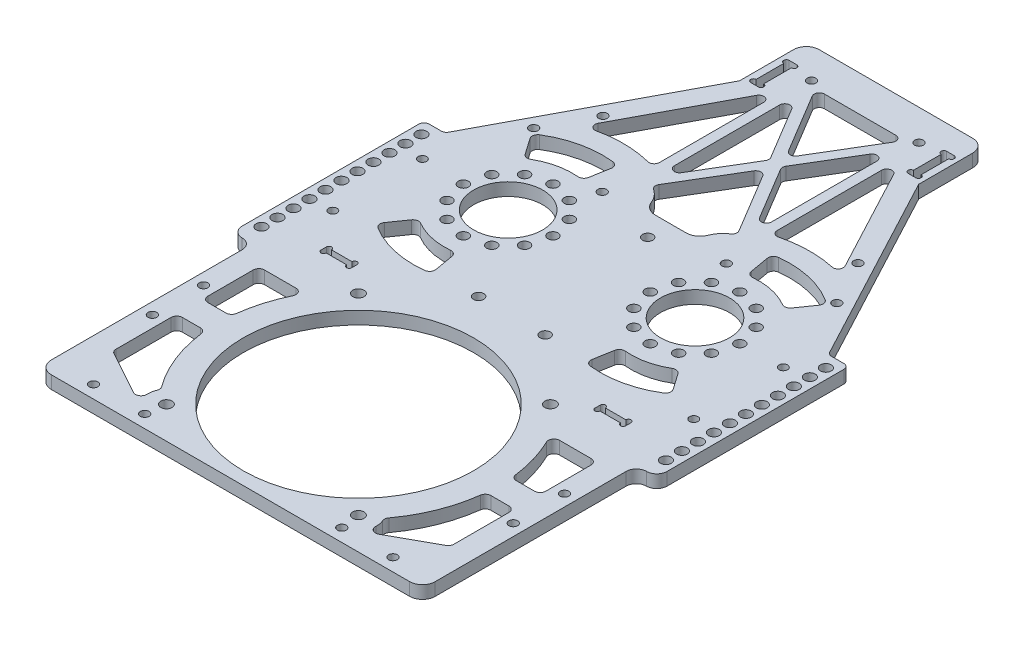
from build123d import *

# Parameters (mm, degrees)
SKETCH_1_R             = 13.5
SKETCH_1_R_2           = 2
SKETCH_1_R_3           = 45
EXTRUDE_1_DEPTH        = 5
SKETCH_3_R             = 1.7
CUT_EXTRUDE_2_DEPTH    = 164.324829711
SKETCH_4_R             = 2.2
CUT_EXTRUDE_3_DEPTH    = 164.324829711
CUT_EXTRUDE_4_DEPTH    = 10
CUT_EXTRUDE_5_DEPTH    = 10
FILLET_1_DEPTH         = 5
CUT_EXTRUDE_6_DEPTH    = 10
FILLET_2_R             = 2
CUT_EXTRUDE_7_DEPTH    = 164.324829711
FILLET_3_R             = 2
FILLET_5_R             = 5
SKETCH_9_R             = 1.05
SKETCH_9_W             = 3
SKETCH_9_H             = 15
CUT_EXTRUDE_8_DEPTH    = 164.324829711
FILLET_3_OF_MIRROR_1_R = 2
FILLET_6_R             = 20
EXTRUDE_START          = -5
EXTRUDE_2_DEPTH        = 5
FILLET_7_R             = 2.2
SKETCH_12_R            = 1
SKETCH_12_W            = 12
SKETCH_12_H            = 2.1
CUT_EXTRUDE_10_DEPTH   = 10
SKETCH_14_R            = 1.5
CUT_EXTRUDE_11_DEPTH   = 164.324829711
CUT_EXTRUDE_12_DEPTH   = 164.324829711
FILLET_8_R             = 10
SKETCH_16_W            = 8
SKETCH_16_H            = 75.05079277
EXTRUDE_3_DEPTH        = 5
FILLET_START           = -1
FILLET_9_DEPTH         = 7
FILLET_9_2_DEPTH       = 5
SKETCH_17_R            = 1.65
CUT_EXTRUDE_13_DEPTH   = 168.149633702
SKETCH_18_R            = 2.1
CUT_EXTRUDE_14_DEPTH   = 168.149633702
FILLET_10_R            = 2
SKETCH_19_R            = 2
CUT_EXTRUDE_15_DEPTH   = 10


with BuildPart() as part:
    # 草图1 → 凸台-拉伸1 (new body)
    with BuildSketch(Plane(origin=(0, 0, 0), x_dir=(1, 0, 0), z_dir=(0, 1, 0))):
        Polygon((-35, 88.881349096), (-75, 13.627385249), (-75, -145), (75, -145), (75, 13.627385249), (35, 88.881349096), (35, 115), (-35, 115), align=None)
        with Locations(Location((36.5, 0, 0), (0, 0, 270))):
            Circle(SKETCH_1_R, mode=Mode.SUBTRACT)
        with Locations(Location((-36.5, 0, 0), (0, 0, 270))):
            Circle(SKETCH_1_R, mode=Mode.SUBTRACT)
        with Locations(Location((36.5, 17.5, 0), (0, 0, 270))):
            Circle(SKETCH_1_R_2, mode=Mode.SUBTRACT)
        with Locations(Location((45.25, 15.155444566, 0), (0, 0, 270))):
            Circle(SKETCH_1_R_2, mode=Mode.SUBTRACT)
        with Locations(Location((51.655444566, 8.75, 0), (0, 0, 270))):
            Circle(SKETCH_1_R_2, mode=Mode.SUBTRACT)
        with Locations(Location((54, 0, 0), (0, 0, 270))):
            Circle(SKETCH_1_R_2, mode=Mode.SUBTRACT)
        with Locations(Location((51.655444566, -8.75, 0), (0, 0, 270))):
            Circle(SKETCH_1_R_2, mode=Mode.SUBTRACT)
        with Locations(Location((45.25, -15.155444566, 0), (0, 0, 270))):
            Circle(SKETCH_1_R_2, mode=Mode.SUBTRACT)
        with Locations(Location((36.5, -17.5, 0), (0, 0, 270))):
            Circle(SKETCH_1_R_2, mode=Mode.SUBTRACT)
        with Locations(Location((27.75, -15.155444566, 0), (0, 0, 270))):
            Circle(SKETCH_1_R_2, mode=Mode.SUBTRACT)
        with Locations(Location((21.344555434, -8.75, 0), (0, 0, 270))):
            Circle(SKETCH_1_R_2, mode=Mode.SUBTRACT)
        with Locations(Location((19, 0, 0), (0, 0, 270))):
            Circle(SKETCH_1_R_2, mode=Mode.SUBTRACT)
        with Locations(Location((21.344555434, 8.75, 0), (0, 0, 270))):
            Circle(SKETCH_1_R_2, mode=Mode.SUBTRACT)
        with Locations(Location((27.75, 15.155444566, 0), (0, 0, 270))):
            Circle(SKETCH_1_R_2, mode=Mode.SUBTRACT)
        with Locations(Location((-36.5, -17.5, 0), (0, 0, 270))):
            Circle(SKETCH_1_R_2, mode=Mode.SUBTRACT)
        with Locations(Location((-45.25, -15.155444566, 0), (0, 0, 270))):
            Circle(SKETCH_1_R_2, mode=Mode.SUBTRACT)
        with Locations(Location((-51.655444566, -8.75, 0), (0, 0, 270))):
            Circle(SKETCH_1_R_2, mode=Mode.SUBTRACT)
        with Locations(Location((-51.655444566, 8.75, 0), (0, 0, 270))):
            Circle(SKETCH_1_R_2, mode=Mode.SUBTRACT)
        with Locations(Location((-45.25, 15.155444566, 0), (0, 0, 270))):
            Circle(SKETCH_1_R_2, mode=Mode.SUBTRACT)
        with Locations(Location((-36.5, 17.5, 0), (0, 0, 270))):
            Circle(SKETCH_1_R_2, mode=Mode.SUBTRACT)
        with Locations(Location((-27.75, 15.155444566, 0), (0, 0, 270))):
            Circle(SKETCH_1_R_2, mode=Mode.SUBTRACT)
        with Locations(Location((-21.344555434, 8.75, 0), (0, 0, 270))):
            Circle(SKETCH_1_R_2, mode=Mode.SUBTRACT)
        with Locations(Location((-21.344555434, -8.75, 0), (0, 0, 270))):
            Circle(SKETCH_1_R_2, mode=Mode.SUBTRACT)
        with Locations(Location((-27.75, -15.155444566, 0), (0, 0, 270))):
            Circle(SKETCH_1_R_2, mode=Mode.SUBTRACT)
        with Locations(Location((-19, 0, 0), (0, 0, 270))):
            Circle(SKETCH_1_R_2, mode=Mode.SUBTRACT)
        with Locations(Location((-54, 0, 0), (0, 0, 270))):
            Circle(SKETCH_1_R_2, mode=Mode.SUBTRACT)
        with Locations(Location((0, -95, 0), (0, 0, 270))):
            Circle(SKETCH_1_R_3, mode=Mode.SUBTRACT)
    extrude(amount=EXTRUDE_1_DEPTH)

    # 草图3 → 切除-拉伸2 (cut, through all)
    with BuildSketch(Plane(origin=(0, 5, 0), x_dir=(1, 0, 0), z_dir=(0, 1, 0))):
        with Locations(Location((49.82296811, 50.341150246, 0), (0, 0, 270))):
            Circle(SKETCH_3_R)
        with Locations(Location((59.209976564, 32.680910376, 0), (0, 0, 270))):
            Circle(SKETCH_3_R)
        with Locations(Location((24.25, 24.5, 0), (0, 0, 270))):
            Circle(SKETCH_3_R)
        with Locations(Location((70.5, -85, 0), (0, 0, 270))):
            Circle(SKETCH_3_R)
        with Locations(Location((70.5, -105, 0), (0, 0, 270))):
            Circle(SKETCH_3_R)
        with Locations(Location((58.5, -140, 0), (0, 0, 270))):
            Circle(SKETCH_3_R)
        with Locations(Location((38.5, -140, 0), (0, 0, 270))):
            Circle(SKETCH_3_R)
        with Locations(Location((21, 103, 0), (0, 0, 270))):
            Circle(SKETCH_3_R)
        with Locations(Location((-21, 103, 0), (0, 0, 90))):
            Circle(SKETCH_3_R)
        with Locations(Location((-38.5, -140, 0), (0, 0, 90))):
            Circle(SKETCH_3_R)
        with Locations(Location((-58.5, -140, 0), (0, 0, 90))):
            Circle(SKETCH_3_R)
        with Locations(Location((-70.5, -105, 0), (0, 0, 90))):
            Circle(SKETCH_3_R)
        with Locations(Location((-70.5, -85, 0), (0, 0, 90))):
            Circle(SKETCH_3_R)
        with Locations(Location((-24.25, 24.5, 0), (0, 0, 90))):
            Circle(SKETCH_3_R)
        with Locations(Location((-59.209976564, 32.680910376, 0), (0, 0, 90))):
            Circle(SKETCH_3_R)
        with Locations(Location((-49.82296811, 50.341150246, 0), (0, 0, 90))):
            Circle(SKETCH_3_R)
    extrude(amount=-CUT_EXTRUDE_2_DEPTH, mode=Mode.SUBTRACT)

    # 草图4 → 切除-拉伸3 (cut, through all)
    with BuildSketch(Plane(origin=(0, 5, 0), x_dir=(1, 0, 0), z_dir=(0, 1, 0))):
        with Locations(Location((37.500010402, -57.500010402, 0), (0, 0, 270))):
            Circle(SKETCH_4_R)
        with Locations(Location((37.499989598, -132.500010402, 0), (0, 0, 270))):
            Circle(SKETCH_4_R)
        with Locations(Location((-37.500010402, -132.499989598, 0), (0, 0, 270))):
            Circle(SKETCH_4_R)
        with Locations(Location((-37.499989598, -57.499989598, 0), (0, 0, 270))):
            Circle(SKETCH_4_R)
    extrude(amount=-CUT_EXTRUDE_3_DEPTH, mode=Mode.SUBTRACT)

    # 草图5 → 切除-拉伸4 (cut)
    with BuildSketch(Plane(origin=(0, 5, 0), x_dir=(1, 0, 0), z_dir=(0, 1, 0))):
        with BuildLine():
            ThreePointArc((57.722328145, 30.308625639), (44.508265716, 36.122952263), (30.075017426, 36.437886861))
            Line((30.075017426, 36.437886861), (32.158795558, 24.620193825))
            ThreePointArc((32.158795558, 24.620193825), (41.910990348, 24.407400178), (50.839410909, 20.478801107))
            Line((50.839410909, 20.478801107), (57.722328145, 30.308625639))
        make_face()
        with BuildLine():
            Line((57.722328145, -30.308625639), (50.839410909, -20.478801107))
            ThreePointArc((50.839410909, -20.478801107), (41.910990348, -24.407400178), (32.158795558, -24.620193825))
            Line((32.158795558, -24.620193825), (30.075017426, -36.437886861))
            ThreePointArc((30.075017426, -36.437886861), (44.508265716, -36.122952263), (57.722328145, -30.308625639))
        make_face()
    cut_extrude_4 = extrude(amount=-CUT_EXTRUDE_4_DEPTH, mode=Mode.SUBTRACT)

    # 草图6 → 切除-拉伸5 (cut)
    with BuildSketch(Plane(origin=(0, 5, 0), x_dir=(1, 0, 0), z_dir=(0, 1, 0))):
        with BuildLine():
            Line((54.772255751, -90), (66, -90))
            Line((66, -90), (66, -40))
            Line((66, -40), (35.155020781, -50.800280654))
            ThreePointArc((35.155020781, -50.800280654), (41.609354889, -51.710460841), (44.601387055, -57.501367529))
            ThreePointArc((44.601387055, -57.501367529), (44.316479978, -59.49247487), (43.484624113, -61.323784866))
            ThreePointArc((43.484624113, -61.323784866), (51.177973179, -74.855148021), (54.772255751, -90))
        make_face()
        with BuildLine():
            Line((40.977955081, -138.804275316), (66, -125))
            Line((66, -125), (66, -100))
            Line((66, -100), (54.772255751, -100))
            ThreePointArc((54.772255751, -100), (51.197014926, -115.096409198), (43.548287119, -128.593848975))
            ThreePointArc((43.548287119, -128.593848975), (44.406064538, -130.463805863), (44.699989598, -132.500010402))
            ThreePointArc((44.699989598, -132.500010402), (43.700044093, -136.160519146), (40.977955081, -138.804275316))
        make_face()
    cut_extrude_5 = extrude(amount=-CUT_EXTRUDE_5_DEPTH, mode=Mode.SUBTRACT)

    # 圆角1: read off the stored shape, not the designer's step
    # 圆角1 outline → 圆角1 (add)
    with BuildSketch(Plane(origin=(0, 0, 0), x_dir=(1, 0, 0), z_dir=(0, 1, 0))):
        with BuildLine():
            ThreePointArc((41.960642067, -51.976420042), (41.174517984, -49.889816616), (42.615339986, -48.188071367))
            Line((42.615339986, -48.188071367), (35.155020781, -50.800280654))
            ThreePointArc((35.155020781, -50.800280654), (38.710477899, -50.505075702), (41.960642067, -51.976420042))
        make_face()
        with BuildLine():
            ThreePointArc((44.303017676, -62.407936169), (43.890494612, -61.363736932), (44.046939144, -60.251957982))
            ThreePointArc((44.046939144, -60.251957982), (43.788663301, -60.799875889), (43.484624113, -61.323784866))
            ThreePointArc((43.484624113, -61.323784866), (43.897168004, -61.863333884), (44.303017676, -62.407936169))
        make_face()
        with BuildLine():
            Line((66, -90), (66, -87.8))
            ThreePointArc((66, -87.8), (65.355634919, -89.355634919), (63.8, -90))
            Line((63.8, -90), (66, -90))
        make_face()
        with BuildLine():
            ThreePointArc((56.745043836, -90), (55.290607652, -89.450640901), (54.56254215, -88.076923077))
            ThreePointArc((54.56254215, -88.076923077), (54.675854491, -89.037539453), (54.772255751, -90))
            Line((54.772255751, -90), (56.745043836, -90))
        make_face()
        with BuildLine():
            ThreePointArc((49.136056437, -21.571510789), (50.717433134, -21.320464273), (52.0501639, -22.207935579))
            Line((52.0501639, -22.207935579), (50.839410909, -20.478801107))
            ThreePointArc((50.839410909, -20.478801107), (49.998794881, -21.04239855), (49.136056437, -21.571510789))
        make_face()
        with BuildLine():
            Line((57.722328145, -30.308625639), (56.420533416, -28.449470091))
            ThreePointArc((56.420533416, -28.449470091), (56.771810685, -30.161691184), (55.763814942, -31.589641243))
            ThreePointArc((55.763814942, -31.589641243), (56.753202111, -30.964621817), (57.722328145, -30.308625639))
        make_face()
        with BuildLine():
            ThreePointArc((31.792244499, -26.699008186), (32.62504719, -25.331449672), (34.164358047, -24.890656413))
            ThreePointArc((34.164358047, -24.890656413), (33.158838982, -24.775726892), (32.158795558, -24.620193825))
            Line((32.158795558, -24.620193825), (31.792244499, -26.699008186))
        make_face()
        with BuildLine():
            ThreePointArc((30.075017426, -36.437886861), (31.230579862, -36.622850946), (32.391413782, -36.771177833))
            ThreePointArc((32.391413782, -36.771177833), (30.874381618, -35.903012984), (30.469131041, -34.202757485))
            Line((30.469131041, -34.202757485), (30.075017426, -36.437886861))
        make_face()
        with BuildLine():
            ThreePointArc((34.164358047, 24.890656413), (32.62504719, 25.331449672), (31.792244499, 26.699008186))
            Line((31.792244499, 26.699008186), (32.158795558, 24.620193825))
            ThreePointArc((32.158795558, 24.620193825), (33.158838982, 24.775726892), (34.164358047, 24.890656413))
        make_face()
        with BuildLine():
            Line((30.075017426, 36.437886861), (30.469131041, 34.202757485))
            ThreePointArc((30.469131041, 34.202757485), (30.874381618, 35.903012984), (32.391413782, 36.771177834))
            ThreePointArc((32.391413782, 36.771177834), (31.230579862, 36.622850946), (30.075017426, 36.437886861))
        make_face()
        with BuildLine():
            ThreePointArc((52.0501639, 22.207935579), (50.717433134, 21.320464273), (49.136056437, 21.571510789))
            ThreePointArc((49.136056437, 21.571510789), (49.998794881, 21.04239855), (50.839410909, 20.478801107))
            Line((50.839410909, 20.478801107), (52.0501639, 22.207935579))
        make_face()
        with BuildLine():
            ThreePointArc((57.722328145, 30.308625639), (56.753202111, 30.964621817), (55.763814942, 31.589641243))
            ThreePointArc((55.763814942, 31.589641243), (56.771810685, 30.161691184), (56.420533416, 28.449470091))
            Line((56.420533416, 28.449470091), (57.722328145, 30.308625639))
        make_face()
        with BuildLine():
            ThreePointArc((54.56254215, -101.923076923), (55.290607652, -100.549359099), (56.745043836, -100))
            Line((56.745043836, -100), (54.772255751, -100))
            ThreePointArc((54.772255751, -100), (54.675854491, -100.962460547), (54.56254215, -101.923076923))
        make_face()
        with BuildLine():
            Line((66, -100), (63.8, -100))
            ThreePointArc((63.8, -100), (65.355634919, -100.644365081), (66, -102.2))
            Line((66, -102.2), (66, -100))
        make_face()
        with BuildLine():
            ThreePointArc((44.119965044, -129.668769492), (43.957031096, -128.553274323), (44.36801473, -127.503527022))
            ThreePointArc((44.36801473, -127.503527022), (43.961531288, -128.051229429), (43.548287119, -128.593848975))
            ThreePointArc((43.548287119, -128.593848975), (43.85688731, -129.119204067), (44.119965044, -129.668769492))
        make_face()
        with BuildLine():
            Line((66, -125), (66, -123.701121217))
            ThreePointArc((66, -123.701121217), (65.694461096, -124.81961), (64.862711675, -125.627424385))
            Line((64.862711675, -125.627424385), (66, -125))
        make_face()
        with BuildLine():
            ThreePointArc((47.94758218, -134.959239803), (45.7131074, -134.894917092), (44.688409016, -132.908209218))
            ThreePointArc((44.688409016, -132.908209218), (43.593743824, -136.334871473), (40.977955081, -138.804275316))
            Line((40.977955081, -138.804275316), (47.94758218, -134.959239803))
        make_face()
    fillet_1 = extrude(amount=FILLET_1_DEPTH)

    # 草图7 → 切除-拉伸6 (cut)
    with BuildSketch(Plane.XZ):
        Polygon((17.467619242, -35), (-17.467619242, -35), (0, -64.112698737), align=None)
        Polygon((-2.332380758, -68), (-19, -40.220634597), (-19, -95.779365403), align=None)
        Polygon((17.467619242, -101), (0, -71.887301263), (-17.467619242, -101), align=None)
        Polygon((19, -40.220634597), (2.332380758, -68), (19, -95.779365403), align=None)
    extrude(amount=-CUT_EXTRUDE_6_DEPTH, mode=Mode.SUBTRACT)

    # 圆角2
    fillet_2_edges = [part.edges().sort_by_distance(p)[0] for p in [
        (17.467619242, 2.5, -101),
        (-17.467619242, 2.5, -101),
        (0, 2.5, -71.887301263),
        (-2.332380758, 2.5, -68),
        (-19, 2.5, -95.779365403),
        (-19, 2.5, -40.220634597),
        (19, 2.5, -95.779365403),
        (2.332380758, 2.5, -68),
        (19, 2.5, -40.220634597),
        (17.467619242, 2.5, -35),
        (0, 2.5, -64.112698737),
        (-17.467619242, 2.5, -35),
    ]]
    fillet(fillet_2_edges, radius=FILLET_2_R)

    # 草图8 → 切除-拉伸7 (cut, through all)
    with BuildSketch(Plane.XZ):
        with BuildLine():
            Line((-50.441337655, -42.785968546), (-23, -94.412704341))
            Line((-23, -94.412704341), (-23, -42.927264064))
            ThreePointArc((-23, -42.927264064), (-36.731702044, -44.999403487), (-50.441337655, -42.785968546))
        make_face()
    cut_extrude_7 = extrude(amount=-CUT_EXTRUDE_7_DEPTH, mode=Mode.SUBTRACT)

    # 圆角3
    fillet_3_edges = [part.edges().sort_by_distance(p)[0] for p in [
        (-23, 2.5, -42.927264064),
        (-23, 2.5, -94.412704341),
        (-50.441337655, 2.5, -42.785968546),
    ]]
    fillet(fillet_3_edges, radius=FILLET_3_R)

    # 圆角5
    fillet_5_edges = [part.edges().sort_by_distance(p)[0] for p in [
        (75, 2.5, 145),
        (-75, 2.5, 145),
        (-35, 2.5, -115),
        (35, 2.5, -115),
    ]]
    fillet(fillet_5_edges, radius=FILLET_5_R)

    # 草图9 → 切除-拉伸8 (cut, through all)
    with BuildSketch(Plane.XZ):
        with Locations((29.25, -91.55)):
            Circle(SKETCH_9_R)
        with Locations((29.25, -104.45)):
            Circle(SKETCH_9_R)
        with Locations((32.25, -104.45)):
            Circle(SKETCH_9_R)
        with Locations((32.25, -91.55)):
            Circle(SKETCH_9_R)
        with Locations((30.75, -98)):
            Rectangle(SKETCH_9_W, SKETCH_9_H)
        with BuildLine():
            ThreePointArc((29.25, -90.5), (28.2, -91.55), (29.25, -92.6))
            Line((29.25, -92.6), (29.25, -90.5))
        make_face()
        with BuildLine():
            Line((29.25, -90.5), (29.25, -92.6))
            ThreePointArc((29.25, -92.6), (29.99246212, -92.29246212), (30.3, -91.55))
            ThreePointArc((30.3, -91.55), (29.99246212, -90.80753788), (29.25, -90.5))
        make_face()
        with BuildLine():
            ThreePointArc((32.25, -90.5), (31.2, -91.55), (32.25, -92.6))
            Line((32.25, -92.6), (32.25, -90.5))
        make_face()
        with BuildLine():
            Line((32.25, -90.5), (32.25, -92.6))
            ThreePointArc((32.25, -92.6), (32.99246212, -92.29246212), (33.3, -91.55))
            ThreePointArc((33.3, -91.55), (32.99246212, -90.80753788), (32.25, -90.5))
        make_face()
        with BuildLine():
            ThreePointArc((32.25, -103.4), (31.2, -104.45), (32.25, -105.5))
            Line((32.25, -105.5), (32.25, -103.4))
        make_face()
        with BuildLine():
            Line((32.25, -103.4), (32.25, -105.5))
            ThreePointArc((32.25, -105.5), (32.99246212, -105.19246212), (33.3, -104.45))
            ThreePointArc((33.3, -104.45), (32.99246212, -103.70753788), (32.25, -103.4))
        make_face()
        with BuildLine():
            ThreePointArc((29.25, -103.4), (28.2, -104.45), (29.25, -105.5))
            Line((29.25, -105.5), (29.25, -103.4))
        make_face()
        with BuildLine():
            Line((29.25, -103.4), (29.25, -105.5))
            ThreePointArc((29.25, -105.5), (29.99246212, -105.19246212), (30.3, -104.45))
            ThreePointArc((30.3, -104.45), (29.99246212, -103.70753788), (29.25, -103.4))
        make_face()
    cut_extrude_8 = extrude(amount=-CUT_EXTRUDE_8_DEPTH, mode=Mode.SUBTRACT)

    # 镜向1: 切除-拉伸4, 切除-拉伸5, 圆角1, 切除-拉伸7, 切除-拉伸8 across plane
    add(cut_extrude_4.mirror(Plane(origin=(0, 0, 0), x_dir=(0, 0, 1), z_dir=(1, 0, 0))), mode=Mode.SUBTRACT)
    add(cut_extrude_5.mirror(Plane(origin=(0, 0, 0), x_dir=(0, 0, 1), z_dir=(1, 0, 0))), mode=Mode.SUBTRACT)
    add(fillet_1.mirror(Plane(origin=(0, 0, 0), x_dir=(0, 0, 1), z_dir=(1, 0, 0))))
    add(cut_extrude_7.mirror(Plane(origin=(0, 0, 0), x_dir=(0, 0, 1), z_dir=(1, 0, 0))), mode=Mode.SUBTRACT)
    add(cut_extrude_8.mirror(Plane(origin=(0, 0, 0), x_dir=(0, 0, 1), z_dir=(1, 0, 0))), mode=Mode.SUBTRACT)

    # 圆角3 of 镜向1
    fillet_3_of_mirror_1_edges = [part.edges().sort_by_distance(p)[0] for p in [
        (23, 2.5, -42.927264064),
        (23, 2.5, -94.412704341),
        (50.441337655, 2.5, -42.785968546),
    ]]
    fillet(fillet_3_of_mirror_1_edges, radius=FILLET_3_OF_MIRROR_1_R)

    # 圆角6
    # the kernel refuses this fillet: 20 mm, written as the material it adds along each edge
    with BuildSketch(Plane(origin=(-66, 5, 40), x_dir=(0.9438150528666441, 0, 0.33047412301469803), z_dir=(0, -1, 0))) as fillet_6_piece_1:
        with BuildLine():
            CenterArc((28.096394515, 19.722573178), FILLET_6_R, 160.702444654, 99.743227102)
            Line((9.220093458, 26.332055639), (0, 0))
            Line((0, 0), (24.776739832, 0))
        make_face()
    extrude(amount=5)
    with BuildSketch(Plane(origin=(66, 5, 40), x_dir=(0, 0, 1), z_dir=(0, -1, 0))) as fillet_6_piece_2:
        with BuildLine():
            CenterArc((27.899592784, 20), FILLET_6_R, 170.256772898, 99.743227102)
            Line((8.188071367, 23.384660014), (0, 0))
            Line((0, 0), (27.899592784, 0))
        make_face()
    extrude(amount=5)

    # 草图10 → 凸台-拉伸2 (add)
    with BuildSketch(Plane.XZ.offset(EXTRUDE_START)):
        with BuildLine():
            ThreePointArc((-44.303017676, 62.407936169), (-46.16318242, 65.100826284), (-47.859878069, 67.899592784))
            Line((-47.859878069, 67.899592784), (-66, 67.899592784))
            ThreePointArc((-66, 67.899592784), (-58.890050421, 52.607549097), (-42.615339986, 48.188071367))
            ThreePointArc((-42.615339986, 48.188071367), (-41.174517984, 49.889816616), (-41.960642067, 51.976420042))
            ThreePointArc((-41.960642067, 51.976420042), (-44.385976867, 55.765734183), (-44.046939144, 60.251957982))
            ThreePointArc((-44.046939144, 60.251957982), (-43.890494612, 61.363736932), (-44.303017676, 62.407936169))
        make_face()
        with BuildLine():
            ThreePointArc((42.615339986, 48.188071367), (58.890050421, 52.607549097), (66, 67.899592784))
            Line((66, 67.899592784), (47.859878069, 67.899592784))
            ThreePointArc((47.859878069, 67.899592784), (46.16318242, 65.100826284), (44.303017676, 62.407936169))
            ThreePointArc((44.303017676, 62.407936169), (43.890494612, 61.363736932), (44.046939144, 60.251957982))
            ThreePointArc((44.046939144, 60.251957982), (44.385976867, 55.765734183), (41.960642067, 51.976420042))
            ThreePointArc((41.960642067, 51.976420042), (41.174517984, 49.889816616), (42.615339986, 48.188071367))
        make_face()
    extrude(amount=EXTRUDE_2_DEPTH)

    # 圆角7
    fillet_7_edges = [part.edges().sort_by_distance(p)[0] for p in [
        (-66, 2.5, 67.899592784),
        (66, 2.5, 67.899592784),
        (-47.859878069, 2.5, 67.899592784),
        (47.859878069, 2.5, 67.899592784),
    ]]
    fillet(fillet_7_edges, radius=FILLET_7_R)

    # 草图12 → 切除-拉伸10 (cut)
    with BuildSketch(Plane.XZ):
        with Locations((48.5, 50.1)):
            Circle(SKETCH_12_R)
        with Locations((48.5, 48)):
            Circle(SKETCH_12_R)
        with Locations((58.5, 50.1)):
            Circle(SKETCH_12_R)
        with Locations((58.5, 48)):
            Circle(SKETCH_12_R)
        with Locations((53.5, 49.05)):
            Rectangle(SKETCH_12_W, SKETCH_12_H)
    cut_extrude_10 = extrude(amount=-CUT_EXTRUDE_10_DEPTH, mode=Mode.SUBTRACT)

    # 镜向2: 切除-拉伸10 across plane
    add(cut_extrude_10.mirror(Plane(origin=(0, 0, 0), x_dir=(0, 0, 1), z_dir=(1, 0, 0))), mode=Mode.SUBTRACT)

    # 草图14 → 切除-拉伸11 (cut, through all)
    with BuildSketch(Plane(origin=(0, 5, 0), x_dir=(1, 0, 0), z_dir=(0, 1, 0))):
        with Locations(Location((-13, -35.04, 0), (0, 0, 270))):
            Circle(SKETCH_14_R)
        with Locations(Location((13, -35.04, 0), (0, 0, 270))):
            Circle(SKETCH_14_R)
        with Locations(Location((0, 18, 0), (0, 0, 270))):
            Circle(SKETCH_14_R)
    extrude(amount=-CUT_EXTRUDE_11_DEPTH, mode=Mode.SUBTRACT)

    # 草图15 → 切除-拉伸12 (cut, through all)
    with BuildSketch(Plane(origin=(0, 5, 0), x_dir=(1, 0, 0), z_dir=(0, 1, 0))):
        with BuildLine():
            Line((-6, 38), (6, 38))
            ThreePointArc((6, 38), (11.5, 32.5), (6, 27))
            Line((6, 27), (-6, 27))
            ThreePointArc((-6, 27), (-11.5, 32.5), (-6, 38))
        make_face()
    extrude(amount=-CUT_EXTRUDE_12_DEPTH, mode=Mode.SUBTRACT)

    # 圆角8
    fillet_8_edges = [part.edges().sort_by_distance(p)[0] for p in [
        (10.898979486, 2.5, -35),
        (-10.898979486, 2.5, -35),
    ]]
    fillet(fillet_8_edges, radius=FILLET_8_R)

    # 草图16 → 凸台-拉伸3 (add)
    with BuildSketch(Plane.XZ):
        with Locations((79, 23.898011136)):
            Rectangle(SKETCH_16_W, SKETCH_16_H)
        with Locations((-79, 23.898011136)):
            Rectangle(SKETCH_16_W, SKETCH_16_H)
    extrude(amount=-EXTRUDE_3_DEPTH)

    # 圆角9: read off the stored shape, not the designer's step
    # 圆角9 outline → 圆角9 (cut)
    with BuildSketch(Plane(origin=(0, 0, 0), x_dir=(1, 0, 0), z_dir=(0, 1, 0)).offset(FILLET_START)):
        with BuildLine():
            Line((-83, -61.423407521), (-79, -61.423407521))
            ThreePointArc((-79, -61.423407521), (-81.828427125, -60.251834646), (-83, -57.423407521))
            Line((-83, -57.423407521), (-83, -61.423407521))
        make_face()
        with BuildLine():
            ThreePointArc((83, -57.423407521), (81.828427125, -60.251834646), (79, -61.423407521))
            Line((79, -61.423407521), (83, -61.423407521))
            Line((83, -61.423407521), (83, -57.423407521))
        make_face()
    extrude(amount=FILLET_9_DEPTH, mode=Mode.SUBTRACT)

    # Fillet 9 2 outline → Fillet 9 2 (add)
    with BuildSketch(Plane(origin=(0, 0, 0), x_dir=(1, 0, 0), z_dir=(0, 1, 0))):
        with BuildLine():
            Line((-75, -61.423407521), (-79, -61.423407521))
            ThreePointArc((-79, -61.423407521), (-76.171572875, -62.594980396), (-75, -65.423407521))
            Line((-75, -65.423407521), (-75, -61.423407521))
        make_face()
        with BuildLine():
            ThreePointArc((75, -65.423407521), (76.171572875, -62.594980396), (79, -61.423407521))
            Line((79, -61.423407521), (75, -61.423407521))
            Line((75, -61.423407521), (75, -65.423407521))
        make_face()
    extrude(amount=FILLET_9_2_DEPTH)

    # 草图17 → 切除-拉伸13 (cut, through all)
    with BuildSketch(Plane(origin=(0, 5, 0), x_dir=(1, 0, 0), z_dir=(0, 1, 0))):
        with Locations(Location((70.5, 0.500036, 0), (0, 0, 270))):
            Circle(SKETCH_17_R)
        with Locations(Location((70.5, -34.499964, 0), (0, 0, 270))):
            Circle(SKETCH_17_R)
        with Locations(Location((-70.5, -34.499964, 0), (0, 0, 270))):
            Circle(SKETCH_17_R)
        with Locations(Location((-70.5, 0.500036, 0), (0, 0, 270))):
            Circle(SKETCH_17_R)
    extrude(amount=-CUT_EXTRUDE_13_DEPTH, mode=Mode.SUBTRACT)

    # 草图18 → 切除-拉伸14 (cut, through all)
    with BuildSketch(Plane.XZ):
        with Locations(Location((79, -8.627385249, 0), (0, 0, 270))):
            Circle(SKETCH_18_R)
        with Locations(Location((-79, -8.627385249, 0), (0, 0, 90))):
            Circle(SKETCH_18_R)
        with Locations(Location((79, -2.377385249, 0), (0, 0, 270))):
            Circle(SKETCH_18_R)
        with Locations(Location((-79, -2.377385249, 0), (0, 0, 90))):
            Circle(SKETCH_18_R)
        with Locations(Location((79, 3.872614751, 0), (0, 0, 270))):
            Circle(SKETCH_18_R)
        with Locations(Location((-79, 3.872614751, 0), (0, 0, 90))):
            Circle(SKETCH_18_R)
        with Locations(Location((79, 10.122614751, 0), (0, 0, 270))):
            Circle(SKETCH_18_R)
        with Locations(Location((-79, 10.122614751, 0), (0, 0, 90))):
            Circle(SKETCH_18_R)
        with Locations(Location((79, 16.372614751, 0), (0, 0, 270))):
            Circle(SKETCH_18_R)
        with Locations(Location((-79, 16.372614751, 0), (0, 0, 90))):
            Circle(SKETCH_18_R)
        with Locations(Location((79, 22.622614751, 0), (0, 0, 270))):
            Circle(SKETCH_18_R)
        with Locations(Location((-79, 22.622614751, 0), (0, 0, 90))):
            Circle(SKETCH_18_R)
        with Locations(Location((79, 28.872614751, 0), (0, 0, 270))):
            Circle(SKETCH_18_R)
        with Locations(Location((-79, 28.872614751, 0), (0, 0, 90))):
            Circle(SKETCH_18_R)
        with Locations(Location((79, 35.122614751, 0), (0, 0, 270))):
            Circle(SKETCH_18_R)
        with Locations(Location((-79, 35.122614751, 0), (0, 0, 90))):
            Circle(SKETCH_18_R)
        with Locations(Location((79, 41.372614751, 0), (0, 0, 270))):
            Circle(SKETCH_18_R)
        with Locations(Location((-79, 41.372614751, 0), (0, 0, 90))):
            Circle(SKETCH_18_R)
        with Locations(Location((79, 47.622614751, 0), (0, 0, 270))):
            Circle(SKETCH_18_R)
        with Locations(Location((-79, 47.622614751, 0), (0, 0, 90))):
            Circle(SKETCH_18_R)
        with Locations(Location((79, 53.872614751, 0), (0, 0, 270))):
            Circle(SKETCH_18_R)
        with Locations(Location((-79, 53.872614751, 0), (0, 0, 90))):
            Circle(SKETCH_18_R)
    extrude(amount=-CUT_EXTRUDE_14_DEPTH, mode=Mode.SUBTRACT)

    # 圆角10
    fillet_10_edges = [part.edges().sort_by_distance(p)[0] for p in [
        (83, 2.5, -13.627385249),
        (-83, 2.5, -13.627385249),
        (75, 2.5, -13.627385249),
        (-75, 2.5, -13.627385249),
    ]]
    fillet(fillet_10_edges, radius=FILLET_10_R)

    # 草图19 → 切除-拉伸15 (cut)
    with BuildSketch(Plane.XZ):
        with Locations(Location((-13, 35.04, 0), (0, 0, 270))):
            Circle(SKETCH_19_R)
        with Locations(Location((13, 35.04, 0), (0, 0, 270))):
            Circle(SKETCH_19_R)
        with Locations(Location((0, -18, 0), (0, 0, 270))):
            Circle(SKETCH_19_R)
    extrude(amount=-CUT_EXTRUDE_15_DEPTH, mode=Mode.SUBTRACT)


solid = part.part
